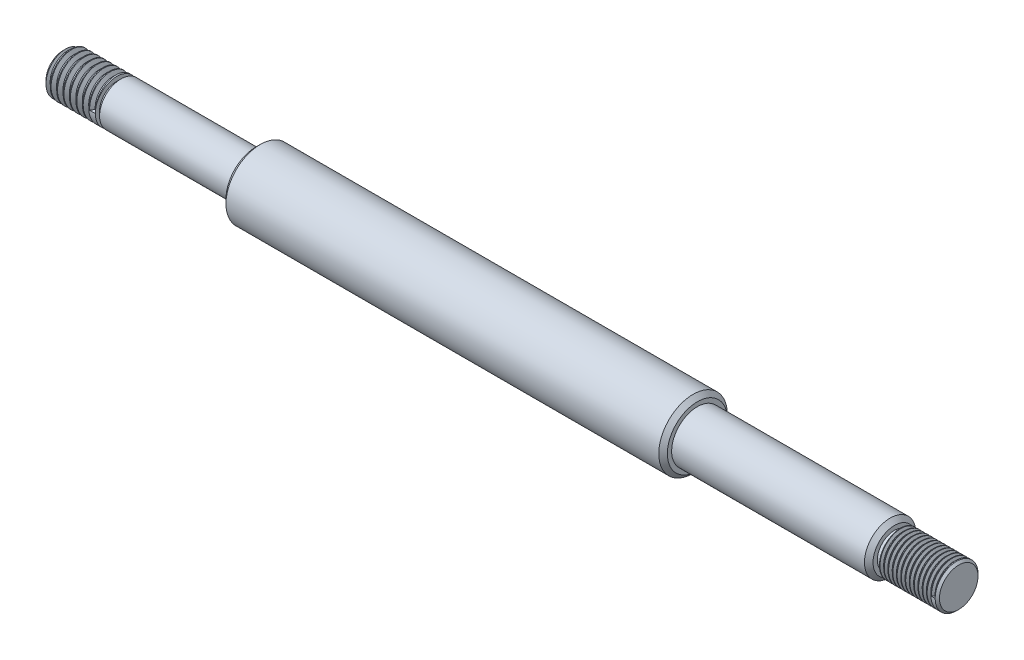
from build123d import *

# Parameters (mm, degrees)
CHAMFER1_SIZE = 0.5
THREAD1_PITCH = 1
CHAMFER2_SIZE = 1
THREAD2_PITCH = 1.5
CHAMFER3_SIZE = 1


with BuildPart() as part:
    # Sketch1 → Revolve1 (revolve)
    with BuildSketch(Plane.XY, mode=Mode.PRIVATE) as revolve1_sk:
        Polygon((-104.5, 0), (-104.5, 5), (-92, 5), (-92, 4), (-91, 4), (-91, 5), (-59.5, 5), (-59.5, 8), (43.5, 8), (43.5, 6), (89.5, 6), (89.5, 4), (90.5, 4), (90.5, 5), (104.5, 5), (104.5, 0), align=None)
    revolve(revolve1_sk.sketch.rotate(Axis((-104.5, 0, 0), (1, 0, 0)), 180), axis=Axis((-104.5, 0, 0), (1, 0, 0)))

    # Chamfer1
    chamfer1_edges = [part.edges().sort_by_distance(p)[0] for p in [
        (104.5, 5, 0),
    ]]
    chamfer(chamfer1_edges, length=CHAMFER1_SIZE)

    # Thread1: the profile of Thread Profile1 profile screwed along a right-hand helix of 13.5 turns, 8 arcs to a turn; built about Z, then put on its axis
    thread1_z = Axis((0, 0, 0), (0, 0, 1))
    thread1_corners = [(5.0003, 0, -0.000173205), (5.0003, 0, 0.875173202), (4.458734125, 0, 0.562499999), (4.458734125, 0, 0.312499999)]
    with BuildLine(mode=Mode.PRIVATE) as thread1_profile:
        Line(thread1_corners[0], thread1_corners[1])
        Line(thread1_corners[1], thread1_corners[2])
        Line(thread1_corners[2], thread1_corners[3])
        Line(thread1_corners[3], thread1_corners[0])
    thread1_cap = Face(thread1_profile.wire())
    thread1_turn_angles = [0, 22.5, 45, 67.5, 90, 112.5, 135, 157.5, 180, 202.5, 225, 247.5, 270, 292.5, 315, 337.5, 360]
    thread1_turn_weights = [1, 0.9238795325112867, 1, 0.9238795325112867, 1, 0.9238795325112867, 1, 0.9238795325112867, 1, 0.9238795325112867, 1, 0.9238795325112867, 1, 0.9238795325112867, 1, 0.9238795325112867, 1]
    thread1_turn_rails = [Edge.make_bspline([Vector(p[0], p[1], 0).rotate(thread1_z, thread1_turn_angles[k]) / thread1_turn_weights[k] + Vector(0, 0, p[2] + THREAD1_PITCH * thread1_turn_angles[k] / 360) for k in range(17)], [0, 0, 0, 1, 1, 2, 2, 3, 3, 4, 4, 5, 5, 6, 6, 7, 7, 8, 8, 8], 2, thread1_turn_weights) for p in thread1_corners]
    thread1_turn_sides = [Face.make_surface_from_curves(thread1_turn_rails[p[0]], thread1_turn_rails[p[1]]) for p in [(0, 1), (1, 2), (2, 3), (3, 0)]]
    thread1_last_angles = [4680, 4702.5, 4725, 4747.5, 4770, 4792.5, 4815, 4837.5, 4860]
    thread1_last_weights = [1, 0.9238795325112867, 1, 0.9238795325112867, 1, 0.9238795325112867, 1, 0.923879532511305, 1]
    thread1_last_rails = [Edge.make_bspline([Vector(p[0], p[1], 0).rotate(thread1_z, thread1_last_angles[k]) / thread1_last_weights[k] + Vector(0, 0, p[2] + THREAD1_PITCH * thread1_last_angles[k] / 360) for k in range(9)], [0, 0, 0, 1, 1, 2, 2, 3, 3, 4, 4, 4], 2, thread1_last_weights) for p in thread1_corners]
    thread1_last_sides = [Face.make_surface_from_curves(thread1_last_rails[p[0]], thread1_last_rails[p[1]]) for p in [(0, 1), (1, 2), (2, 3), (3, 0)]]
    thread1 = Plane(origin=(104, 0, 0), x_dir=(0, 0, 1), z_dir=(-1, 0, 0)) * Solid(Shell([*[p.moved(Location((0, 0, THREAD1_PITCH * i))) for i in range(13) for p in thread1_turn_sides], *thread1_last_sides, thread1_cap, thread1_cap.rotate(thread1_z, 4860).moved(Location((0, 0, THREAD1_PITCH * 4860 / 360)))]))
    add(thread1, mode=Mode.SUBTRACT)

    # Chamfer2
    chamfer2_edges = [part.edges().sort_by_distance(p)[0] for p in [
        (-104.5, 5, 0),
    ]]
    chamfer(chamfer2_edges, length=CHAMFER2_SIZE)

    # Thread2: the profile of Thread Profile2 profile screwed along a right-hand helix of 7.666667 turns, 8 arcs to a turn; built about Z, then put on its axis
    thread2_z = Axis((0, 0, 0), (0, 0, 1))
    thread2_corners = [(5.0003, 0, -0.000173205), (5.0003, 0, 1.312673201), (4.188101188, 0, 0.843749998), (4.188101188, 0, 0.468749998)]
    with BuildLine(mode=Mode.PRIVATE) as thread2_profile:
        Line(thread2_corners[0], thread2_corners[1])
        Line(thread2_corners[1], thread2_corners[2])
        Line(thread2_corners[2], thread2_corners[3])
        Line(thread2_corners[3], thread2_corners[0])
    thread2_cap = Face(thread2_profile.wire())
    thread2_turn_angles = [0, 22.5, 45, 67.5, 90, 112.5, 135, 157.5, 180, 202.5, 225, 247.5, 270, 292.5, 315, 337.5, 360]
    thread2_turn_weights = [1, 0.9238795325112867, 1, 0.9238795325112867, 1, 0.9238795325112867, 1, 0.9238795325112867, 1, 0.9238795325112867, 1, 0.9238795325112867, 1, 0.9238795325112867, 1, 0.9238795325112867, 1]
    thread2_turn_rails = [Edge.make_bspline([Vector(p[0], p[1], 0).rotate(thread2_z, thread2_turn_angles[k]) / thread2_turn_weights[k] + Vector(0, 0, p[2] + THREAD2_PITCH * thread2_turn_angles[k] / 360) for k in range(17)], [0, 0, 0, 1, 1, 2, 2, 3, 3, 4, 4, 5, 5, 6, 6, 7, 7, 8, 8, 8], 2, thread2_turn_weights) for p in thread2_corners]
    thread2_turn_sides = [Face.make_surface_from_curves(thread2_turn_rails[p[0]], thread2_turn_rails[p[1]]) for p in [(0, 1), (1, 2), (2, 3), (3, 0)]]
    thread2_last_angles = [2520, 2542.5, 2565, 2587.5, 2610, 2632.5, 2655, 2677.5, 2700, 2722.5, 2745, 2752.5, 2760]
    thread2_last_weights = [1, 0.9238795325112867, 1, 0.9238795325112867, 1, 0.9238795325112867, 1, 0.9238795325112867, 1, 0.9238795325112867, 1, 0.9914448613738006, 1]
    thread2_last_rails = [Edge.make_bspline([Vector(p[0], p[1], 0).rotate(thread2_z, thread2_last_angles[k]) / thread2_last_weights[k] + Vector(0, 0, p[2] + THREAD2_PITCH * thread2_last_angles[k] / 360) for k in range(13)], [0, 0, 0, 1, 1, 2, 2, 3, 3, 4, 4, 5, 5, 6, 6, 6], 2, thread2_last_weights) for p in thread2_corners]
    thread2_last_sides = [Face.make_surface_from_curves(thread2_last_rails[p[0]], thread2_last_rails[p[1]]) for p in [(0, 1), (1, 2), (2, 3), (3, 0)]]
    thread2 = Plane(origin=(-92, 0, 0), x_dir=(0, 0, 1), z_dir=(-1, 0, 0)) * Solid(Shell([*[p.moved(Location((0, 0, THREAD2_PITCH * i))) for i in range(7) for p in thread2_turn_sides], *thread2_last_sides, thread2_cap, thread2_cap.rotate(thread2_z, 2760).moved(Location((0, 0, THREAD2_PITCH * 2760 / 360)))]))
    add(thread2, mode=Mode.SUBTRACT)

    # Chamfer3
    chamfer3_edges = [part.edges().sort_by_distance(p)[0] for p in [
        (89.5, 6, 0),
        (43.5, 8, 0),
        (-59.5, 8, 0),
    ]]
    chamfer(chamfer3_edges, length=CHAMFER3_SIZE)


solid = part.part
